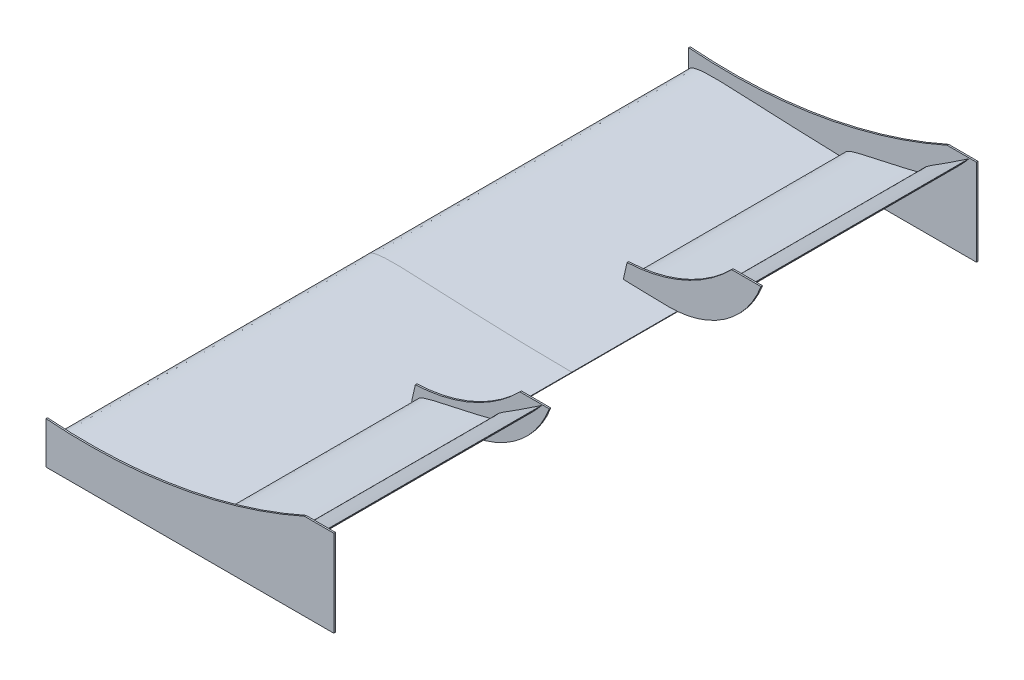
from build123d import *

# Parameters (mm, degrees)
BOSS_EXTRUDE1_DEPTH = 409.117647
BOSS_EXTRUDE3_DEPTH = 275.00588235
BOSS_EXTRUDE4_DEPTH = 275.00588235
BOSS_EXTRUDE5_START = -2
BOSS_EXTRUDE5_DEPTH = 2
BOSS_EXTRUDE9_DEPTH = 2
SCALE1_SCALE        = 1.7


# Read off the part's stored shape, not the designer's step: Boss-Extrude5
with BuildPart() as part:
    # Sketch4 → Boss-Extrude1 (new body)
    with BuildSketch(Plane.XY):
        with BuildLine():
            Line((260, 0.338), (260, -0.338))
            add(Edge.make_bspline(
                [(260, -0.338), (255.671134416, -1.516414962), (247.034293782, -3.867558011), (229.732198635, -8.142516043), (208.095332328, -12.865824713), (182.070295086, -17.52187714), (156.065433036, -21.33839003), (130.04608131, -24.060706609), (104.028996678, -25.758589144), (82.309621921, -25.775760663), (64.967929801, -24.576004726), (51.944088226, -22.995710172), (38.892098593, -20.665234217), (28.076374793, -17.862506322), (19.409165866, -15.031867898), (12.873889977, -12.359614398), (7.297636497, -9.469642807), (2.457443903, -6.012727152), (-1.755975169, -0.452912883), (2.791856276, 3.799118742), (7.432468627, 5.468199276), (12.959118785, 6.594755148), (19.486078925, 7.167527694), (28.163063188, 7.572890101), (39.002713335, 7.542528182), (52.005642383, 7.178662792), (64.99939665, 6.485838665), (82.332797947, 5.675168232), (103.995849486, 4.634859687), (130.000749859, 3.658001845), (155.997296268, 2.573284486), (181.996330165, 1.649383439), (207.997446916, 0.969796253), (229.66601603, 0.624750289), (246.999604816, 0.397519697), (255.666612935, 0.357839542), (260, 0.338)],
                knots=[0, 0, 0, 0, 0.025304886, 0.050487653, 0.100520433, 0.150190716, 0.199586607, 0.248740009, 0.297715539, 0.346600594, 0.371102737, 0.395726297, 0.420570145, 0.445825119, 0.458702216, 0.471919982, 0.485786003, 0.493461051, 0.506863029, 0.51614777, 0.522766003, 0.535269014, 0.547551134, 0.559786371, 0.584228898, 0.60868081, 0.633151284, 0.657621757, 0.706558114, 0.75548187, 0.804405627, 0.853320224, 0.902221408, 0.951113136, 0.975557228, 1, 1, 1, 1], degree=3))
        make_face()
    extrude(amount=BOSS_EXTRUDE1_DEPTH)


with BuildPart() as body_2:
    # Sketch7 → Boss-Extrude3 (new body)
    with BuildSketch(Plane.XY.offset(136.11111111)):
        with BuildLine():
            Line((315.870723, 39.20897), (315.951475, 38.907601))
            add(Edge.make_bspline(
                [(315.951475, 38.907601), (314.162382578, 37.865145197), (310.592831717, 35.78526438), (303.390016539, 31.812615724), (294.308265411, 27.122279449), (283.262183068, 21.937734339), (272.124806483, 17.129879311), (260.850263498, 12.808098108), (249.454357747, 8.943291101), (239.773652509, 6.34114928), (231.899202412, 4.804464985), (225.904245036, 3.953215779), (219.807125691, 3.433045796), (214.650547504, 3.390543338), (210.448468632, 3.617134945), (207.21575065, 4.027785995), (204.384568854, 4.650059029), (201.813807887, 5.613008864), (199.27126803, 7.588326051), (200.790819383, 10.027193325), (202.660279447, 11.325634111), (204.989553739, 12.488051205), (207.830929407, 13.523078656), (211.650810078, 14.740301317), (216.486882257, 16.021615518), (222.327208641, 17.41266421), (228.202740217, 18.655963806), (236.027016072, 20.36511664), (245.808932451, 22.489094306), (257.518917899, 25.160012954), (269.238063033, 27.781848898), (280.939106657, 30.475676099), (292.611894114, 33.278670937), (302.313218201, 35.71326156), (310.067882177, 37.682543093), (313.936477602, 38.700170205), (315.870723, 39.20897)],
                knots=[0, 0, 0, 0, 0.025304886, 0.050487653, 0.100520434, 0.150190715, 0.199586607, 0.248740009, 0.297715539, 0.346600597, 0.371102739, 0.395726298, 0.420570145, 0.44582512, 0.458702215, 0.471919982, 0.485786005, 0.493461052, 0.50686303, 0.516147769, 0.522766005, 0.535269017, 0.547551134, 0.559786372, 0.584228898, 0.608680812, 0.633151286, 0.657621756, 0.706558117, 0.755481873, 0.804405629, 0.853320227, 0.90222141, 0.951113137, 0.97555723, 1, 1, 1, 1], degree=3))
        make_face()
    extrude(amount=BOSS_EXTRUDE3_DEPTH)



with BuildPart() as body_3:
    # Sketch8 → Boss-Extrude4 (new body)
    with BuildSketch(Plane.XY.offset(136.11111111)):
        with BuildLine():
            Line((357.288448, 80.224893), (357.392839, 80.075808))
            add(Edge.make_bspline(
                [(357.392839, 80.075808), (356.620122763, 79.14743677), (355.078419259, 77.29517444), (351.922757302, 73.680504701), (347.880336886, 69.297560959), (342.859759573, 64.251808822), (337.713984567, 59.394326829), (332.396045475, 54.775920248), (326.920407777, 50.383794268), (322.133048059, 47.02600566), (318.123223552, 44.612619584), (315.006896562, 42.949941587), (311.768516646, 41.448359544), (308.950396673, 40.396264989), (306.601803062, 39.682106717), (304.74784604, 39.262242045), (303.071771935, 39.038489289), (301.470479137, 39.053437498), (299.682676349, 39.628948524), (300.029041565, 41.268992156), (300.794740272, 42.353716288), (301.839624042, 43.455618804), (303.190637013, 44.589859378), (305.041668965, 46.019196952), (307.436944014, 47.686407794), (310.360811955, 49.614130635), (313.333455795, 51.467887671), (317.281367644, 53.965802203), (322.219606269, 57.08167597), (328.105602635, 60.882029467), (334.006411273, 64.657308071), (339.882935631, 68.46843545), (345.7221912, 72.333766121), (350.554281154, 75.603825383), (354.412136757, 78.230441634), (356.329694769, 79.560087793), (357.288448, 80.224893)],
                knots=[0, 0, 0, 0, 0.025304887, 0.050487658, 0.100520434, 0.150190719, 0.199586612, 0.248740011, 0.29771554, 0.346600599, 0.371102739, 0.395726301, 0.420570148, 0.445825123, 0.458702221, 0.471919982, 0.485786004, 0.49346105, 0.50686303, 0.516147773, 0.522766001, 0.535269015, 0.547551138, 0.559786368, 0.584228897, 0.608680812, 0.633151286, 0.657621759, 0.706558116, 0.755481872, 0.804405626, 0.853320226, 0.902221408, 0.951113136, 0.975557225, 1, 1, 1, 1], degree=3))
        make_face()
    extrude(amount=BOSS_EXTRUDE4_DEPTH)


with BuildPart() as body_2_1:
    add(body_2.part)

    add(body_3.part)  # Boss-Extrude5 merges body 3
    # Boss-Extrude5 outline → Boss-Extrude5 (add)
    with BuildSketch(Plane.XY.offset(136.11111111).offset(BOSS_EXTRUDE5_START)):
        with BuildLine():
            Line((196.395689019, 22.773764987), (191.568888201, 1.411668558))
            add(Edge.make_bspline(
                [(191.568888201, 1.411668558), (202.116980655, 1.144472356), (217.251064759, 0.835003016), (224.976192116, 0.705806864), (233.767864274, 0.575264806), (242.420543536, 0.462749318), (249.546395985, 0.395469517)],
                knots=[0, 0, 0, 0, 0, 0, 0, 1, 1, 1, 1, 1, 1, 1], degree=6))
            ThreePointArc((249.546395985, 0.395469517), (321.210428694, 22.475081792), (367.332879449, 81.601745816))
            Line((367.332879449, 81.601745816), (329.919724454, 81.601745816))
            ThreePointArc((329.919724454, 81.601745816), (268.759443908, 39.473286164), (196.395689019, 22.773764987))
        make_face()
    extrude(amount=BOSS_EXTRUDE5_DEPTH)


with BuildPart() as body_3_2:
    # Sketch11 → Boss-Extrude9 (new body)
    with BuildSketch(Plane.XY.offset(409.117647)):
        with BuildLine():
            Line((0, -29.009579655), (0, 24.532221423))
            ThreePointArc((0, 24.532221423), (168.532063733, 32.416036391), (329.919724454, 81.601745816))
            Line((329.919724454, 81.601745816), (367.332879449, 81.601745816))
            Line((367.332879449, 81.601745816), (367.332879449, -29.009579655))
            Line((367.332879449, -29.009579655), (0, -29.009579655))
        make_face()
    extrude(amount=BOSS_EXTRUDE9_DEPTH)


with BuildPart() as body_2_2:
    # Scale1: scaled about (0, 0, 0)
    add(body_2_1.part.scale(SCALE1_SCALE))


with BuildPart() as body_3_2_1:
    # Scale1: scaled about (0, 0, 0)
    add(body_3_2.part.scale(SCALE1_SCALE))


with BuildPart() as part_1:
    # Scale1: scaled about (0, 0, 0)
    add(part.part.scale(SCALE1_SCALE))


with BuildPart() as body_4:
    # Mirror4: mirrored copy
    add(part_1.part.mirror(Plane.XY))


with BuildPart() as body_5:
    # Mirror4 2: mirrored copy
    add(body_2_2.part.mirror(Plane.XY))


with BuildPart() as body_6:
    # Mirror4 3: mirrored copy
    add(body_3_2_1.part.mirror(Plane.XY))


solid = Compound([body_2_2.part, body_3_2_1.part, part_1.part, body_4.part, body_5.part, body_6.part])
